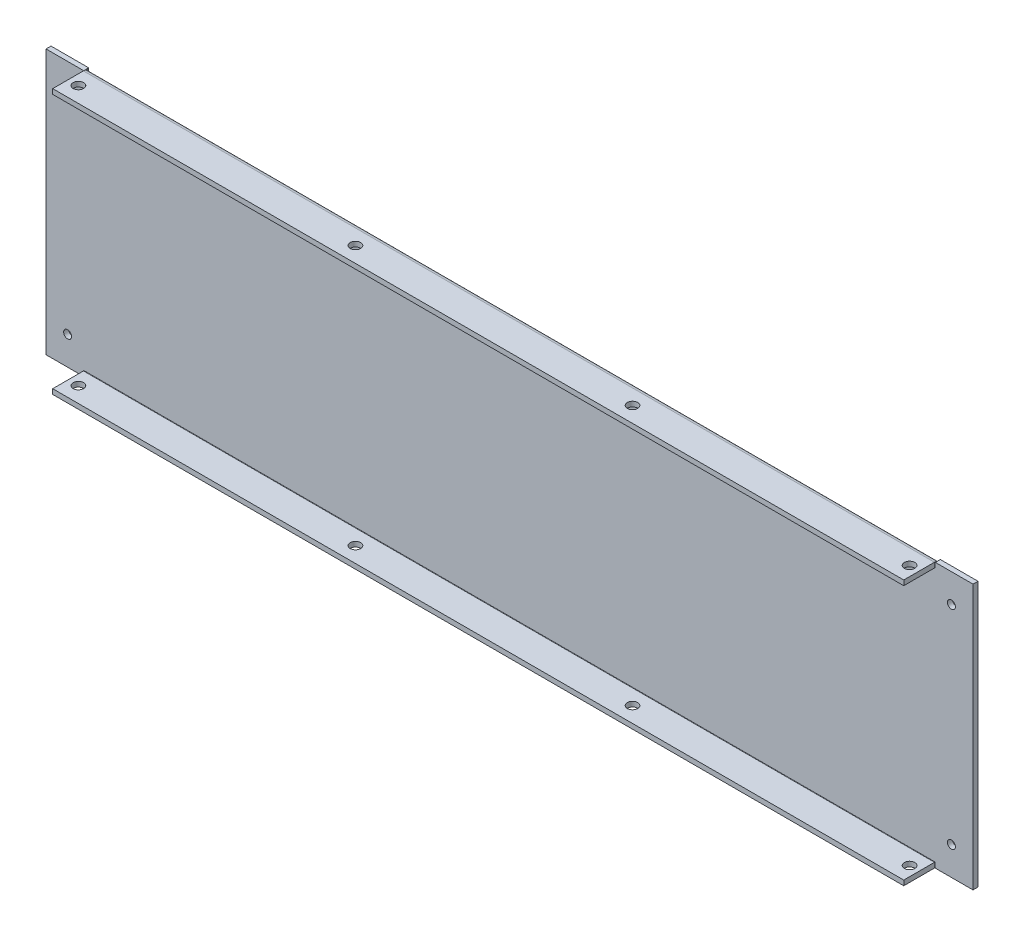
from build123d import *

# Parameters (mm, degrees)
SKETCH1_W                      = 424.942
SKETCH1_H                      = 121.412
SKETCH1_R                      = 1.8288
BASE_FLANGE1_DEPTH             = 2.286
SKETCH4_W                      = 0.0254
SKETCH4_H                      = 0.254
SKETCH4_W_2                    = 0.254
CUT_EXTRUDE1_DEPTH             = 2.286
EDGE_FLANGE1_STRIP_W           = 9.4488
EDGE_FLANGE1_STRIP_H           = 2.286
EDGE_FLANGE1_STRIP_CUT_DEPTH   = 390.1186
EDGE_FLANGE1_STRIP_2_W         = 9.4488
EDGE_FLANGE1_STRIP_2_H         = 2.286
EDGE_FLANGE1_STRIP_CUT_2_DEPTH = 390.1186
EDGE_FLANGE1_DEPTH             = 390.1186
EDGE_FLANGE1_BEND_DEPTH        = 390.1186
SKETCH10_R                     = 2.3876
CUT_EXTRUDE2_DEPTH             = 443.175190715


# Sheet-metal steps are written as plain solids
with BuildPart() as part:
    # Sketch1 → Base-Flange1 (new body)
    with BuildSketch(Plane.XY):
        with Locations((212.471, 60.706)):
            Rectangle(SKETCH1_W, SKETCH1_H)
        with Locations((9.906, 13.081)):
            Circle(SKETCH1_R, mode=Mode.SUBTRACT)
        with Locations((415.036, 13.081)):
            Circle(SKETCH1_R, mode=Mode.SUBTRACT)
        with Locations((9.906, 108.331)):
            Circle(SKETCH1_R, mode=Mode.SUBTRACT)
        with Locations((415.036, 108.331)):
            Circle(SKETCH1_R, mode=Mode.SUBTRACT)
    extrude(amount=-BASE_FLANGE1_DEPTH)

    # Sketch4 → Cut-Extrude1 (cut)
    with BuildSketch(Plane.XY):
        with Locations((17.2847, 121.285)):
            Rectangle(SKETCH4_W, SKETCH4_H)
        with Locations((407.543, 121.285)):
            Rectangle(SKETCH4_W_2, SKETCH4_H)
        with Locations((407.543, 0.127)):
            Rectangle(SKETCH4_W_2, SKETCH4_H)
        with Locations((17.2847, 0.127)):
            Rectangle(SKETCH4_W, SKETCH4_H)
    extrude(amount=-CUT_EXTRUDE1_DEPTH, mode=Mode.SUBTRACT)

    # Edge-Flange1 strip (across the edge) → Edge-Flange1 strip cut (cut)
    with BuildSketch(Plane(origin=(407.416, 121.412, 0), x_dir=(0, -1, 0), z_dir=(-1, 0, 0))):
        with Locations((-2.286, -1.143)):
            Rectangle(EDGE_FLANGE1_STRIP_W, EDGE_FLANGE1_STRIP_H)
    extrude(amount=EDGE_FLANGE1_STRIP_CUT_DEPTH, mode=Mode.SUBTRACT)

    # Edge-Flange1 strip 2 (across the edge) → Edge-Flange1 strip cut 2 (cut)
    with BuildSketch(Plane.YZ.offset(17.2974)):
        with Locations((-2.286, -1.143)):
            Rectangle(EDGE_FLANGE1_STRIP_2_W, EDGE_FLANGE1_STRIP_2_H)
    extrude(amount=EDGE_FLANGE1_STRIP_CUT_2_DEPTH, mode=Mode.SUBTRACT)

    # Edge-Flange1 section (across the edge) → Edge-Flange1 (add)
    with BuildSketch(Plane(origin=(407.416, 121.412, 0), x_dir=(0, -1, 0), z_dir=(-1, 0, 0))):
        with BuildLine():
            Line((0, 0.1524), (0, 14.224))
            Line((0, 14.224), (2.286, 14.224))
            Line((2.286, 14.224), (2.286, 0.1524))
            ThreePointArc((2.286, 0.1524), (2.330636927, 0.044636927), (2.4384, 0))
            Line((2.4384, 0), (2.4384, -2.286))
            ThreePointArc((2.4384, -2.286), (0.714190825, -1.571809175), (0, 0.1524))
        make_face()
    extrude(amount=EDGE_FLANGE1_DEPTH)

    # Edge-Flange1 section 2 (across the edge) → Edge-Flange1 bend (add)
    with BuildSketch(Plane.YZ.offset(17.2974)):
        with BuildLine():
            Line((0, 0.1524), (0, 14.224))
            Line((0, 14.224), (2.286, 14.224))
            Line((2.286, 14.224), (2.286, 0.1524))
            ThreePointArc((2.286, 0.1524), (2.330636927, 0.044636927), (2.4384, 0))
            Line((2.4384, 0), (2.4384, -2.286))
            ThreePointArc((2.4384, -2.286), (0.714190825, -1.571809175), (0, 0.1524))
        make_face()
    extrude(amount=EDGE_FLANGE1_BEND_DEPTH)

    # Sketch10 → Cut-Extrude2 (cut, through all)
    with BuildSketch(Plane(origin=(0, 121.412, 0), x_dir=(-1, 0, 0), z_dir=(0, 1, 0))):
        with Locations(Location((-402.971, 7.112, 0), (0, 0, 90))):
            Circle(SKETCH10_R)
        with Locations(Location((-275.971, 7.112, 0), (0, 0, 90))):
            Circle(SKETCH10_R)
        with Locations(Location((-148.971, 7.112, 0), (0, 0, 90))):
            Circle(SKETCH10_R)
        with Locations(Location((-21.971, 7.112, 0), (0, 0, 90))):
            Circle(SKETCH10_R)
    extrude(amount=-CUT_EXTRUDE2_DEPTH, mode=Mode.SUBTRACT)


solid = part.part
